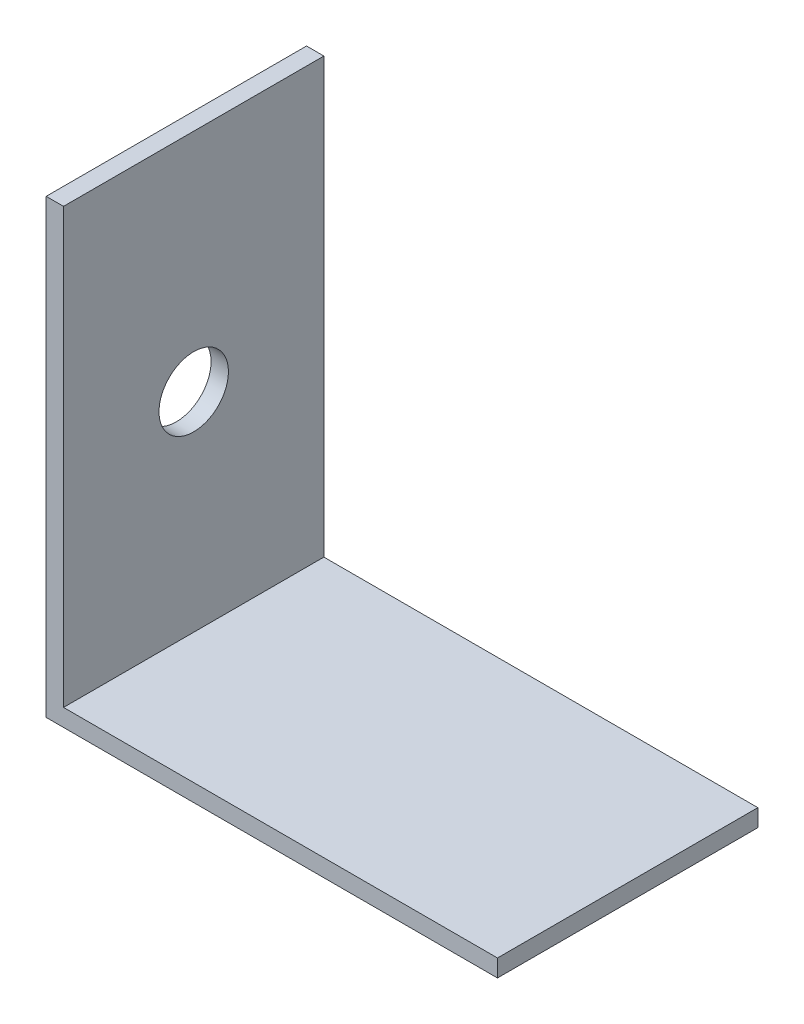
from build123d import *

# Parameters (mm, degrees)
RESSALTO_EXTRUS_O1_DEPTH = 15
ESBO_O2_R                = 2
CORTE_EXTRUS_O1_DEPTH    = 15


with BuildPart() as part:
    # Esboço1 → Ressalto-extrusão1 (new body)
    with BuildSketch(Plane.XY):
        Polygon((0, 0), (25, 0), (25, -1), (-1, -1), (-1, 25), (0, 25), align=None)
    extrude(amount=RESSALTO_EXTRUS_O1_DEPTH)

    # Esboço2 → Corte-extrusão1 (cut)
    with BuildSketch(Plane(origin=(0, 0, 0), x_dir=(0, 0, -1), z_dir=(1, 0, 0))):
        with Locations((-7.5, 12)):
            Circle(ESBO_O2_R)
    extrude(amount=-CORTE_EXTRUS_O1_DEPTH, mode=Mode.SUBTRACT)


solid = part.part
